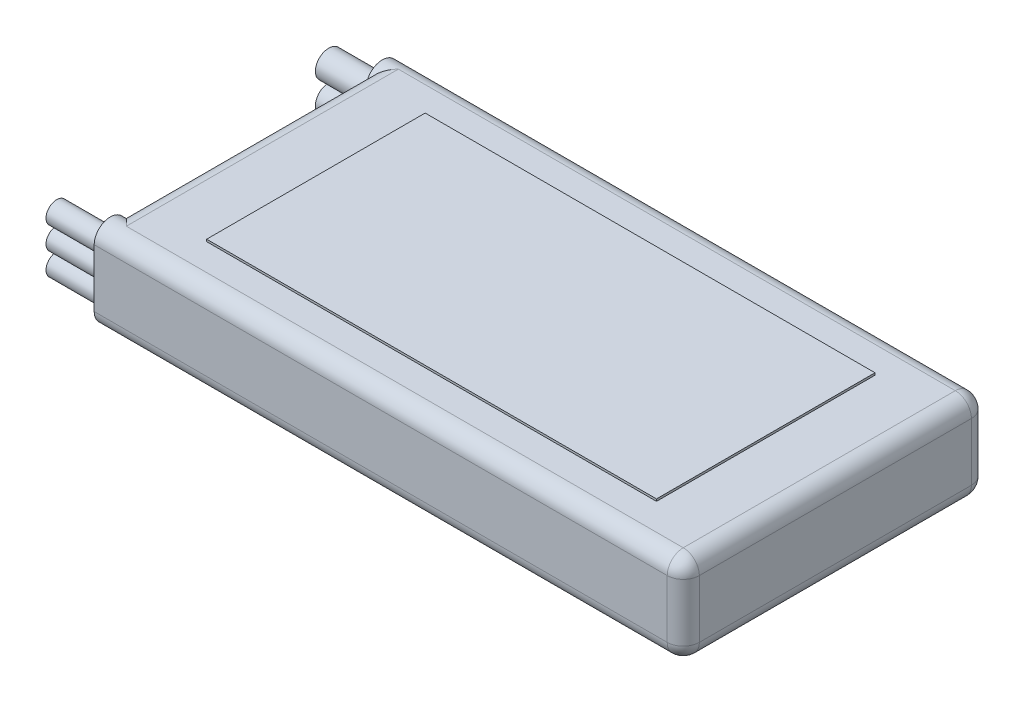
from build123d import *

# Parameters (mm, degrees)
SKETCH1_W       = 69.85
SKETCH1_H       = 36.068
BATTERY_DEPTH   = 10.668
FILLET_2_R      = 1.905
WIRE_BOSS_DEPTH = 5.08
SKETCH3_R       = 1.27
SKETCH3_R_2     = 1.5875
WIRES_2_DEPTH   = 6.35
SKETCH4_W       = 53.34
SKETCH4_H       = 25.908
LABEL_DEPTH     = 0.254


with BuildPart() as part:
    # Sketch1 → Battery (new body)
    with BuildSketch(Plane(origin=(0, 0, 0), x_dir=(1, 0, 0), z_dir=(0, 1, 0))):
        with Locations((8.399917755, 5.125761329)):
            Rectangle(SKETCH1_W, SKETCH1_H)
    extrude(amount=BATTERY_DEPTH)

    # Fillet 2
    fillet_2_edges = [part.edges().sort_by_distance(p)[0] for p in [
        (43.324917755, 5.334, 12.908238671),
        (8.399917755, 0, 12.908238671),
        (43.324917755, 0, -5.125761329),
        (-26.525082245, 5.334, 12.908238671),
        (-26.525082245, 0, -5.125761329),
        (43.324917755, 5.334, -23.159761329),
        (-26.525082245, 5.334, -23.159761329),
        (8.399917755, 0, -23.159761329),
        (8.399917755, 10.668, -23.159761329),
        (43.324917755, 10.668, -5.125761329),
        (8.399917755, 10.668, 12.908238671),
        (-26.525082245, 10.668, -5.125761329),
    ]]
    fillet(fillet_2_edges, radius=FILLET_2_R)

    # Sketch2 → Wire Boss (add)
    with BuildSketch(Plane.ZY.offset(26.525082245)):
        with BuildLine():
            Line((12.908238671, 8.763), (12.908238671, 1.905))
            ThreePointArc((12.908238671, 1.905), (11.003238671, 0), (9.098238671, 1.905))
            Line((9.098238671, 1.905), (9.098238671, 8.763))
            ThreePointArc((9.098238671, 8.763), (11.003238671, 10.668), (12.908238671, 8.763))
        make_face()
        with BuildLine():
            Line((-19.349761329, 8.763), (-19.349761329, 1.905))
            ThreePointArc((-19.349761329, 1.905), (-21.254761329, 0), (-23.159761329, 1.905))
            Line((-23.159761329, 1.905), (-23.159761329, 8.763))
            ThreePointArc((-23.159761329, 8.763), (-21.254761329, 10.668), (-19.349761329, 8.763))
        make_face()
    extrude(amount=-WIRE_BOSS_DEPTH)

    # Sketch3 → Wires 2 (add)
    with BuildSketch(Plane.ZY.offset(26.525082245)):
        with Locations((11.003238671, 8.001)):
            Circle(SKETCH3_R)
        with Locations((11.003238671, 5.334)):
            Circle(SKETCH3_R)
        with Locations((11.003238671, 2.667)):
            Circle(SKETCH3_R)
        with Locations((-21.254761329, 7.112)):
            Circle(SKETCH3_R_2)
        with Locations((-21.254761329, 3.556)):
            Circle(SKETCH3_R_2)
    extrude(amount=WIRES_2_DEPTH)

    # Sketch4 → Label (add)
    with BuildSketch(Plane(origin=(0, 10.668, 0), x_dir=(1, 0, 0), z_dir=(0, 1, 0))):
        with Locations((8.399917755, 5.125761329)):
            Rectangle(SKETCH4_W, SKETCH4_H)
    extrude(amount=LABEL_DEPTH)


solid = part.part
